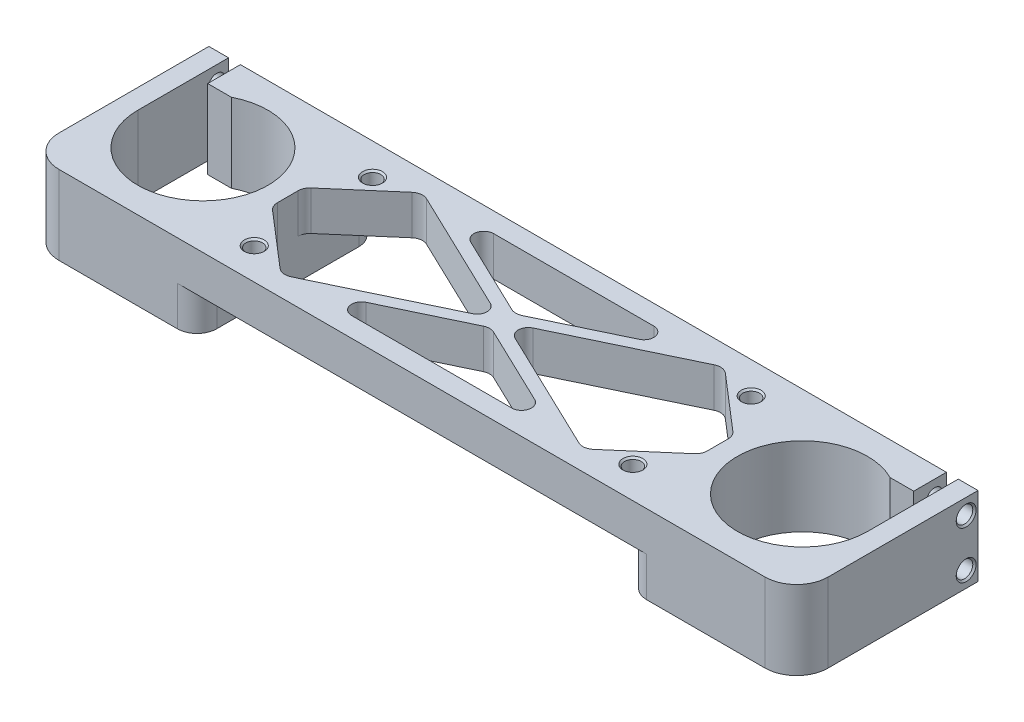
from build123d import *

# Parameters (mm, degrees)
SKETCH1_W                  = 109
SKETCH1_H                  = 46
BOSS_EXTRUDE1_DEPTH        = 10
BOSS_EXTRUDE2_DEPTH        = 20
FILLET1_R                  = 5
CUT_EXTRUDE1_DEPTH         = 103.153071417
M5_TAPPED_HOLE2_AT_2_COUNT = 2
M5_TAPPED_HOLE2_AT_2_PITCH = 12
FILLET2_R                  = 2.5
FILLET3_R                  = 3


# Read off the part's stored shape, not the designer's step: M5 Tapped Hole1
with BuildPart() as part:
    # Sketch1 → Boss-Extrude1 (new body)
    with BuildSketch(Plane(origin=(0, 0, 0), x_dir=(1, 0, 0), z_dir=(0, 1, 0))):
        Rectangle(SKETCH1_W, SKETCH1_H)
    extrude(amount=-BOSS_EXTRUDE1_DEPTH)

    # Sketch1<3> → Boss-Extrude2 (add)
    with BuildSketch(Plane(origin=(0, 0, 0), x_dir=(1, 0, 0), z_dir=(0, 1, 0))):
        with BuildLine():
            Line((-54.5, -23), (-54.5, 23))
            Line((-54.5, 23), (-89.5, 23))
            Line((-89.5, 23), (-89.5, 14.7))
            Line((-89.5, 14.7), (-83.493997598, 14.7))
            ThreePointArc((-83.493997598, 14.7), (-61.930512441, -8.619716922), (-92.5, 0))
            Line((-92.5, 0), (-92.5, 23))
            Line((-92.5, 23), (-97.5, 23))
            Line((-97.5, 23), (-97.5, -15))
            ThreePointArc((-97.5, -15), (-95.156854249, -20.656854249), (-89.5, -23))
            Line((-89.5, -23), (-54.5, -23))
        make_face()
        with BuildLine():
            Line((92.5, 23), (92.5, 0))
            ThreePointArc((92.5, 0), (61.930512441, -8.619716922), (83.493997598, 14.7))
            Line((83.493997598, 14.7), (89.5, 14.7))
            Line((89.5, 14.7), (89.5, 23))
            Line((89.5, 23), (54.5, 23))
            Line((54.5, 23), (54.5, -23))
            Line((54.5, -23), (89.5, -23))
            ThreePointArc((89.5, -23), (95.156854249, -20.656854249), (97.5, -15))
            Line((97.5, -15), (97.5, 23))
            Line((97.5, 23), (92.5, 23))
        make_face()
    extrude(amount=-BOSS_EXTRUDE2_DEPTH)

    # Fillet1
    fillet1_edges = [part.edges().sort_by_distance(p)[0] for p in [
        (-54.5, -15, -23),
        (-54.5, -15, 23),
        (54.5, -15, 23),
        (54.5, -15, -23),
    ]]
    fillet(fillet1_edges, radius=FILLET1_R)

    # M5 Tapped Hole1 outline → M5 Tapped Hole1 (revolve, cut)
    with BuildSketch(Plane(origin=(48, 0, -15), x_dir=(1, 0, 0), z_dir=(0, 0, 1))):
        Polygon((0, -10), (2.1, -10), (2.1, -0.425), (2.525, 0), (0, 0), align=None)
    revolve(axis=Axis((48, 0, -15), (0, 1, 0)), mode=Mode.SUBTRACT)

    # M5 Tapped Hole1 2 outline → M5 Tapped Hole1 2 (revolve, cut)
    with BuildSketch(Plane(origin=(-48, 0, 15), x_dir=(1, 0, 0), z_dir=(0, 0, 1))):
        Polygon((0, -10), (2.1, -10), (2.1, -0.425), (2.525, 0), (0, 0), align=None)
    revolve(axis=Axis((-48, 0, 15), (0, 1, 0)), mode=Mode.SUBTRACT)

    # M5 Tapped Hole1 3 outline → M5 Tapped Hole1 3 (revolve, cut)
    with BuildSketch(Plane(origin=(-48, 0, -15), x_dir=(1, 0, 0), z_dir=(0, 0, 1))):
        Polygon((0, -10), (2.1, -10), (2.1, -0.425), (2.525, 0), (0, 0), align=None)
    revolve(axis=Axis((-48, 0, -15), (0, 1, 0)), mode=Mode.SUBTRACT)

    # M5 Tapped Hole1 4 outline → M5 Tapped Hole1 4 (revolve, cut)
    with BuildSketch(Plane(origin=(48, 0, 15), x_dir=(1, 0, 0), z_dir=(0, 0, 1))):
        Polygon((0, -10), (2.1, -10), (2.1, -0.425), (2.525, 0), (0, 0), align=None)
    revolve(axis=Axis((48, 0, 15), (0, 1, 0)), mode=Mode.SUBTRACT)

    # Sketch7 → Cut-Extrude1 (cut, through all)
    with BuildSketch(Plane(origin=(0, 0, 0), x_dir=(1, 0, 0), z_dir=(0, 1, 0))):
        Polygon((-31.298535282, 18), (31.298535282, 18), (0, 3), align=None)
        Polygon((-54.5, 4), (-54.5, -4), (-38.24, -18), (-0.681757662, 0), (-38.24, 18), align=None)
        Polygon((31.298535282, -18), (0, -3), (-31.298535282, -18), align=None)
        Polygon((38.24, -18), (0.681757662, 0), (38.24, 18), (54.5, 4), (54.5, -4), align=None)
    extrude(amount=-CUT_EXTRUDE1_DEPTH, mode=Mode.SUBTRACT)

    # Sketch9 → M5 Tapped Hole2 (revolve, cut)
    with BuildSketch(Plane(origin=(97.5, -4, -20), x_dir=(0, 0, -1), z_dir=(0, 1, 0))):
        Polygon((0, 0), (0, 17.2618073), (2.1, 16), (2.1, 0.425), (2.525, 0), align=None)
    m5_tapped_hole2 = revolve(axis=Axis((103.85, -4, -20), (-1, 0, 0)), mode=Mode.SUBTRACT)

    # M5 Tapped Hole2 at 2: M5 Tapped Hole2 ×2
    with Locations(*[(0, -i * M5_TAPPED_HOLE2_AT_2_PITCH, 0) for i in range(1, M5_TAPPED_HOLE2_AT_2_COUNT)]):
        add(m5_tapped_hole2, mode=Mode.SUBTRACT)

    # Mirror1: M5 Tapped Hole2 across plane
    add(m5_tapped_hole2.mirror(Plane(origin=(0, 0, 0), x_dir=(0, 0, 1), z_dir=(1, 0, 0))), mode=Mode.SUBTRACT)

    # Mirror1 copy 1 sketch → Mirror1 copy 1 (revolve, cut)
    with BuildSketch(Plane(origin=(-97.5, -16, -20), x_dir=(0, 0, -1), z_dir=(0, 1, 0))):
        Polygon((0, 0), (0, -17.2618073), (2.1, -16), (2.1, -0.425), (2.525, 0), align=None)
    revolve(axis=Axis((-103.85, -16, -20), (-1, 0, 0)), mode=Mode.SUBTRACT)

    # Fillet2
    fillet2_edges = [part.edges().sort_by_distance(p)[0] for p in [
        (31.298535282, -5, 18),
        (-31.298535282, -5, 18),
        (-0.681757662, -5, 0),
        (0.681757662, -5, 0),
        (-31.298535282, -5, -18),
        (31.298535282, -5, -18),
    ]]
    fillet(fillet2_edges, radius=FILLET2_R)

    # Fillet3
    fillet3_edges = [part.edges().sort_by_distance(p)[0] for p in [
        (0, -5, 3),
        (-38.24, -5, -18),
        (-54.5, -5, -4),
        (-38.24, -5, 18),
        (-54.5, -5, 4),
        (38.24, -5, 18),
        (54.5, -5, 4),
        (38.24, -5, -18),
        (54.5, -5, -4),
        (0, -5, -3),
    ]]
    fillet(fillet3_edges, radius=FILLET3_R)


solid = part.part
